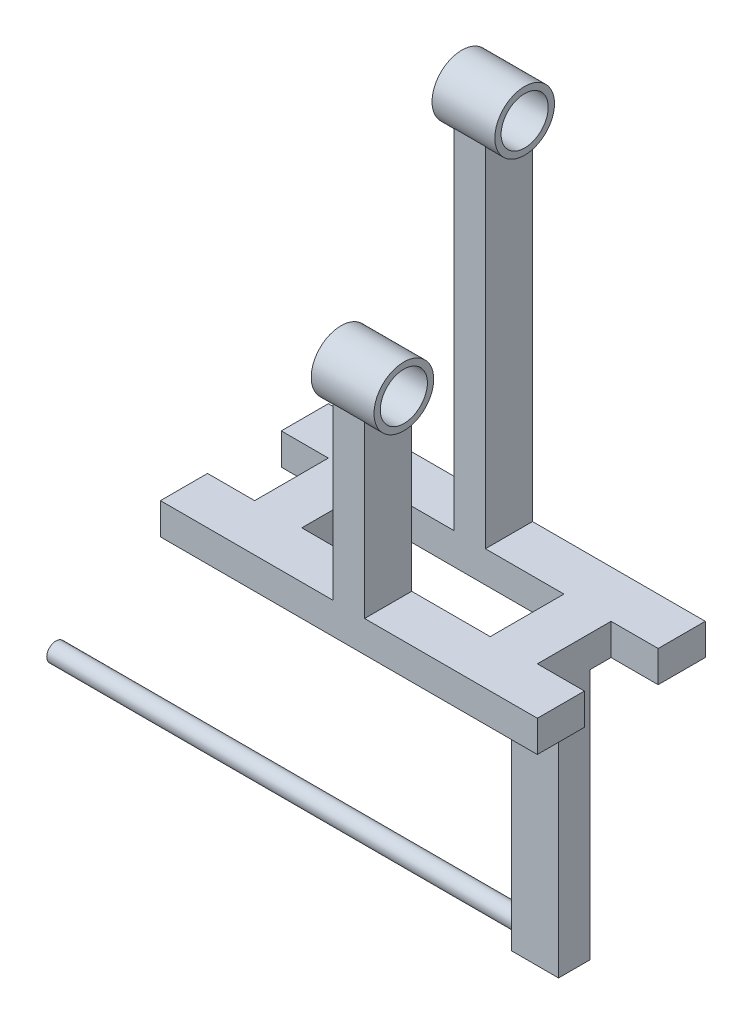
from build123d import *

# Parameters (mm, degrees)
SKETCH2_W               = 60
SKETCH2_H               = 23.4666089
BOSS_EXTRUDE2_DEPTH     = 10
SKETCH3_W               = 10
SKETCH3_H               = 15
BOSS_EXTRUDE3_DEPTH     = 60
SKETCH4_W               = 10
SKETCH4_H               = 15
BOSS_EXTRUDE4_DEPTH     = 56.7502592
SKETCH6_R               = 9.5
SKETCH6_R_2             = 7.5
EXTRUDE_THIN1_DEPTH     = 10
CUT_EXTRUDE1_DEPTH      = 157.290369402
CUT_EXTRUDE1_DEPTH_BACK = 157.290369402
SKETCH8_W               = 15
SKETCH8_H               = 10
BOSS_EXTRUDE5_DEPTH     = 80
SKETCH9_R               = 2.95
BOSS_EXTRUDE6_DEPTH     = 150


with BuildPart() as part:
    # Sketch2 → Boss-Extrude2 (new body)
    with BuildSketch(Plane(origin=(0, 0, 0), x_dir=(1, 0, 0), z_dir=(0, 1, 0))):
        Polygon((60, -15), (-60, -15), (-60, 0), (-45, 0), (-45, 23.4666089), (-60, 23.4666089), (-60, 38.4666089), (60, 38.4666089), (60, 23.4666089), (45, 23.4666089), (45, 0), (60, 0), align=None)
        with Locations((0, 11.73330445)):
            Rectangle(SKETCH2_W, SKETCH2_H, mode=Mode.SUBTRACT)
    extrude(amount=BOSS_EXTRUDE2_DEPTH)

    # Sketch3 → Boss-Extrude3 (add)
    with BuildSketch(Plane(origin=(0, 10, 0), x_dir=(1, 0, 0), z_dir=(0, 1, 0))):
        with Locations((0, -7.5)):
            Rectangle(SKETCH3_W, SKETCH3_H)
        with Locations((0, 30.9666089)):
            Rectangle(SKETCH3_W, SKETCH3_H)
    extrude(amount=BOSS_EXTRUDE3_DEPTH)

    # Sketch4 → Boss-Extrude4 (add)
    with BuildSketch(Plane(origin=(0, 70, 0), x_dir=(1, 0, 0), z_dir=(0, 1, 0))):
        with Locations((0, 30.9666089)):
            Rectangle(SKETCH4_W, SKETCH4_H)
    extrude(amount=BOSS_EXTRUDE4_DEPTH)

    # Sketch6 → Extrude-Thin1 (add, symmetric)
    # profile 1 of 2: a face of its own
    with BuildSketch(Plane(origin=(0, 0, 0), x_dir=(0, 0, -1), z_dir=(1, 0, 0))):
        with Locations((-7.5, 70)):
            Circle(SKETCH6_R)
        with Locations((-7.5, 70)):
            Circle(SKETCH6_R_2, mode=Mode.SUBTRACT)
    # profile 2 of 2: a face of its own
    with BuildSketch(Plane(origin=(0, 0, 0), x_dir=(0, 0, -1), z_dir=(1, 0, 0))):
        with Locations((30.9666089, 126.7502592)):
            Circle(SKETCH6_R)
        with Locations((30.9666089, 126.7502592)):
            Circle(SKETCH6_R_2, mode=Mode.SUBTRACT)
    extrude(amount=EXTRUDE_THIN1_DEPTH, both=True)

    # Sketch7 → Cut-Extrude1 (cut, two sides: drawn at the far end of the back side and taken through both)
    with BuildSketch(Plane(origin=(5, 0, 0), x_dir=(0, 0, -1), z_dir=(1, 0, 0)).offset(-CUT_EXTRUDE1_DEPTH_BACK)):
        with BuildLine():
            Line((0, 70), (-15, 70))
            ThreePointArc((-15, 70), (-7.5, 62.5), (0, 70))
        make_face()
        with BuildLine():
            Line((38.4666089, 126.7502592), (23.4666089, 126.7502592))
            ThreePointArc((23.4666089, 126.7502592), (30.9666089, 119.2502592), (38.4666089, 126.7502592))
        make_face()
    extrude(amount=CUT_EXTRUDE1_DEPTH + CUT_EXTRUDE1_DEPTH_BACK, mode=Mode.SUBTRACT)

    # Sketch8 → Boss-Extrude5 (add)
    with BuildSketch(Plane.XZ):
        with Locations((37.5, -11.75)):
            Rectangle(SKETCH8_W, SKETCH8_H)
    extrude(amount=BOSS_EXTRUDE5_DEPTH)

    # Sketch9 → Boss-Extrude6 (add)
    with BuildSketch(Plane.ZY.offset(-30)):
        with Locations((-11.75, -75)):
            Circle(SKETCH9_R)
    extrude(amount=BOSS_EXTRUDE6_DEPTH)


solid = part.part
